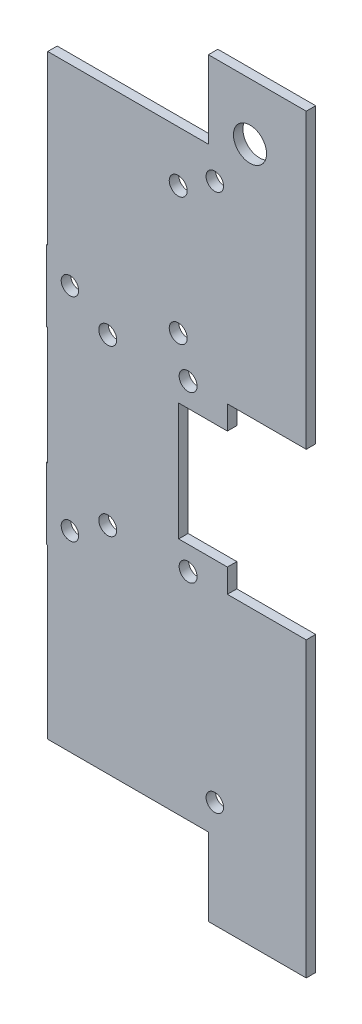
from build123d import *

# Parameters (mm, degrees)
SKETCH1_R               = 2.3495
SKETCH1_R_2             = 4.445
BOSS_EXTRUDE1_DEPTH     = 2.54
SKETCH2_R               = 2.413
CUT_EXTRUDE1_DEPTH      = 217.884748371
SKETCH3_W               = 13.08488816
SKETCH3_H               = 31.623
CUT_EXTRUDE2_DEPTH      = 217.884748371
SKETCH4_W               = 12.77569874
SKETCH4_H               = 24.435209008
SKETCH4_W_2             = 40.233428475
SKETCH4_H_2             = 28.333759116
CUT_EXTRUDE3_DEPTH      = 217.884748371
SKETCH5_R               = 2.413
CUT_EXTRUDE4_DEPTH      = 217.884748371
CUT_EXTRUDE5_DEPTH      = 217.884748371
CUT_EXTRUDE5_DEPTH_BACK = 217.884748371


with BuildPart() as part:
    # Sketch1 → Boss-Extrude1 (new body)
    with BuildSketch(Plane.XY):
        Polygon((-2.930050059, -104.509781075), (-3.314938219, -104.509781075), (-3.314938219, -110.859781075), (-3.314938219, -123.559781075), (-2.930050059, -123.559781075), (-2.930050059, -168.708281075), (38.709428475, -168.708281075), (38.709428475, -189.536281075), (105.397061781, -189.536281075), (66.517436481, -110.859781075), (45.329949941, -110.859781075), (45.329949941, -104.509781075), (45.329949941, -72.886781075), (45.329949941, -66.536781075), (66.517436481, -66.536781075), (105.397061781, 12.139718925), (38.709428475, 12.139718925), (38.709428475, -8.688281075), (-2.930050059, -8.688281075), (-2.930050059, -53.836781075), (-3.314938219, -53.836781075), (-3.314938219, -66.536781075), (-3.314938219, -72.886781075), (-2.930050059, -72.886781075), align=None)
        with Locations((90.673911143, 2.614718925)):
            Circle(SKETCH1_R, mode=Mode.SUBTRACT)
        with Locations((41.95655448, -16.435281075)):
            Circle(SKETCH1_R, mode=Mode.SUBTRACT)
        with Locations((3.035061781, -60.186781075)):
            Circle(SKETCH1_R, mode=Mode.SUBTRACT)
        with Locations((3.035061781, -117.209781075)):
            Circle(SKETCH1_R, mode=Mode.SUBTRACT)
        with Locations((41.95655448, -160.961281075)):
            Circle(SKETCH1_R, mode=Mode.SUBTRACT)
        with Locations((90.673911143, -180.011281075)):
            Circle(SKETCH1_R, mode=Mode.SUBTRACT)
        with Locations((51.409428475, -3.100281075)):
            Circle(SKETCH1_R_2, mode=Mode.SUBTRACT)
    extrude(amount=BOSS_EXTRUDE1_DEPTH)

    # Sketch2 → Cut-Extrude1 (cut, through all)
    with BuildSketch(Plane.XY.offset(2.54)):
        with Locations((13.195061781, -66.536781075)):
            Circle(SKETCH2_R)
        with Locations((34.785061781, -66.536781075)):
            Circle(SKETCH2_R)
        with Locations((34.785061781, -110.859781075)):
            Circle(SKETCH2_R)
        with Locations((13.195061781, -110.859781075)):
            Circle(SKETCH2_R)
    extrude(amount=-CUT_EXTRUDE1_DEPTH, mode=Mode.SUBTRACT)

    # Sketch3 → Cut-Extrude2 (cut, through all)
    with BuildSketch(Plane.XY.offset(2.54)):
        with Locations((38.787505861, -88.698281075)):
            Rectangle(SKETCH3_W, SKETCH3_H)
    extrude(amount=-CUT_EXTRUDE2_DEPTH, mode=Mode.SUBTRACT)

    # Sketch4 → Cut-Extrude3 (cut, through all)
    with BuildSketch(Plane.XY.offset(2.54)):
        with Locations((33.845579105, 3.529323429)):
            Rectangle(SKETCH4_W, SKETCH4_H)
        with Locations((20.116714238, -182.875160633)):
            Rectangle(SKETCH4_W_2, SKETCH4_H_2)
    extrude(amount=-CUT_EXTRUDE3_DEPTH, mode=Mode.SUBTRACT)

    # Sketch5 → Cut-Extrude4 (cut, through all)
    with BuildSketch(Plane(origin=(0, 0, 0), x_dir=(-1, 0, 0), z_dir=(0, 0, -1))):
        with Locations((-32.121949941, -22.404281075)):
            Circle(SKETCH5_R)
        with Locations((-32.121949941, -56.694281075)):
            Circle(SKETCH5_R)
    extrude(amount=-CUT_EXTRUDE4_DEPTH, mode=Mode.SUBTRACT)

    # Sketch7 → Cut-Extrude5 (cut, two sides: drawn at the far end of the back side and taken through both)
    with BuildSketch(Plane.XY.offset(2.54).offset(-CUT_EXTRUDE5_DEPTH_BACK)):
        Polygon((66.517436481, -66.536781075), (66.517436481, 21.52212206), (127.820808625, 21.52212206), (115.78217236, -200.256310461), (66.517436481, -200.256310461), (66.517436481, -110.859781075), align=None)
    extrude(amount=CUT_EXTRUDE5_DEPTH + CUT_EXTRUDE5_DEPTH_BACK, mode=Mode.SUBTRACT)


solid = part.part
